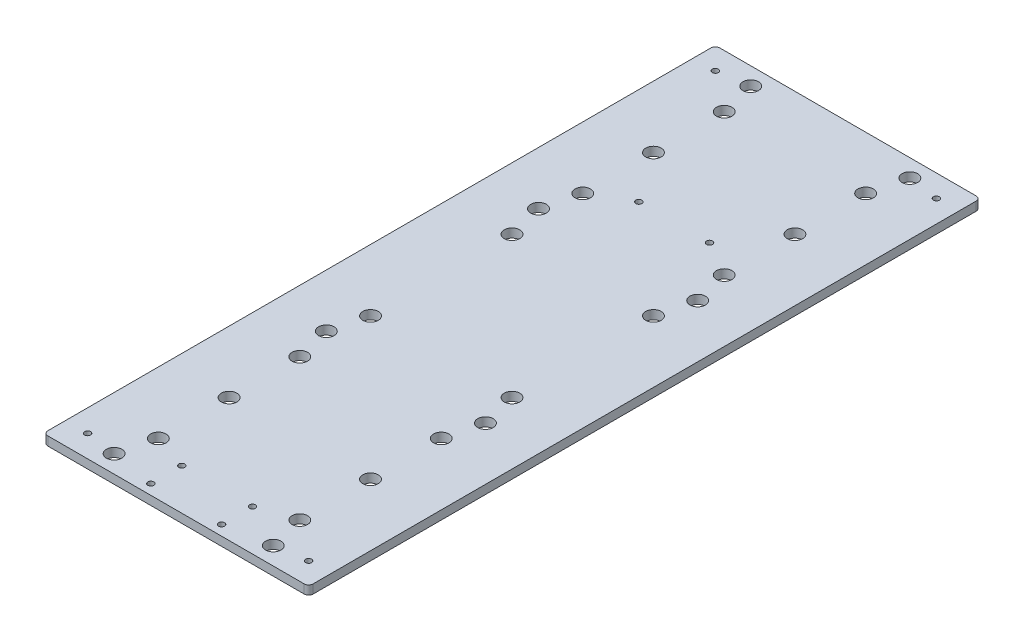
from build123d import *

# Parameters (mm, degrees)
BOSS_EXTRUDE1_DEPTH   = 10
M8_TAPPED_HOLE_D      = 6.8
M16_CLEARANCE_HOLE1_D = 17.5
M8_TAPPED_HOLE2_D     = 6.8


with BuildPart() as part:
    # Sketch1 → Boss-Extrude1 (new body)
    with BuildSketch(Plane.XZ.offset(-29.143326369)):
        with BuildLine():
            Line((-35.300605602, 578.433128803), (-325.300605602, 578.433128803))
            ThreePointArc((-325.300605602, 578.433128803), (-328.836139508, 576.968662709), (-330.300605602, 573.433128803))
            Line((-330.300605602, 573.433128803), (-330.300605602, -176.566871197))
            ThreePointArc((-330.300605602, -176.566871197), (-328.836139508, -180.102405103), (-325.300605602, -181.566871197))
            Line((-325.300605602, -181.566871197), (-35.300605602, -181.566871197))
            ThreePointArc((-35.300605602, -181.566871197), (-31.765071696, -180.102405103), (-30.300605602, -176.566871197))
            Line((-30.300605602, -176.566871197), (-30.300605602, 573.433128803))
            ThreePointArc((-30.300605602, 573.433128803), (-31.765071696, 576.968662709), (-35.300605602, 578.433128803))
        make_face()
    extrude(amount=BOSS_EXTRUDE1_DEPTH)

    # M8 Tapped Hole (through all)
    with Locations(Plane(origin=(-171.596169666, 38.143326369, 73.097017265), x_dir=(1, 0, 0), z_dir=(0, 1, 0))):
        with Locations((-48.704435936, -458.836111538), (-48.704435936, -493.836111538), (31.295564064, -493.836111538), (31.295564064, -458.836111538), (31.295564064, 58.078352635), (-48.704435936, 58.078352635)):
            Hole(M8_TAPPED_HOLE_D / 2)

    # M16 Clearance Hole1 (through all)
    with Locations(Plane(origin=(0, 29.143326369, 0), x_dir=(1, 0, 0), z_dir=(0, 1, 0))):
        with Locations((-270.300605602, -78.433128803), (-90.300605602, -78.433128803), (-90.300605602, -318.433128803), (-270.300605602, -318.433128803), (-270.300605602, 161.566871197), (-90.300605602, 161.566871197), (-270.300605602, -558.433128803), (-90.300605602, -558.433128803), (-260.300605602, 121.566871197), (-260.300605602, 41.566871197), (-260.300605602, -118.433128803), (-260.300605602, -278.433128803), (-260.300605602, -358.433128803), (-260.300605602, -438.433128803), (-260.300605602, -518.433128803), (-100.300605602, -518.433128803), (-100.300605602, -438.433128803), (-100.300605602, -358.433128803), (-100.300605602, -278.433128803), (-100.300605602, -118.433128803), (-100.300605602, 41.566871197), (-100.300605602, -38.433128803), (-260.300605602, -38.433128803), (-100.300605602, 121.566871197)):
            Hole(M16_CLEARANCE_HOLE1_D / 2)

    # M8 Tapped Hole2 (through all)
    with Locations(Plane(origin=(-180.641700914, 19.143326369, 85.599274265), x_dir=(-1, 0, 0), z_dir=(0, -1, 0))):
        with Locations((124.658904688, -467.833854538), (-125.341095312, -467.833854538), (124.658904688, 242.166145462), (-125.341095312, 242.166145462)):
            Hole(M8_TAPPED_HOLE2_D / 2)


solid = part.part
